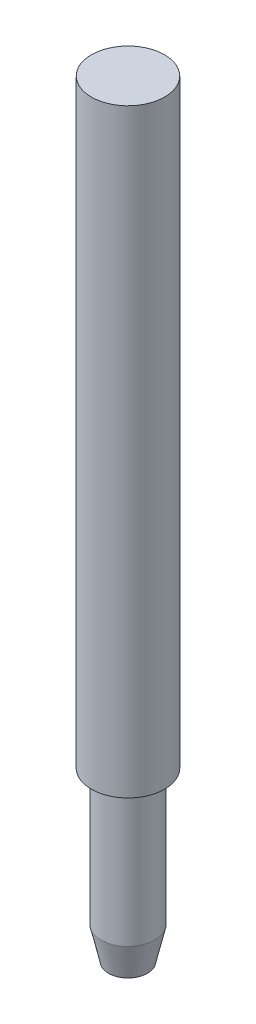
from build123d import *

# Parameters (mm, degrees)
SKETCH1_R           = 2.38125
BOSS_EXTRUDE1_DEPTH = 38.9763
SKETCH2_R           = 1.7526
BOSS_EXTRUDE2_DEPTH = 10.922


with BuildPart() as part:
    # Sketch1 → Boss-Extrude1 (new body)
    with BuildSketch(Plane(origin=(0, 0, 0), x_dir=(1, 0, 0), z_dir=(0, 1, 0))):
        Circle(SKETCH1_R)
    extrude(amount=BOSS_EXTRUDE1_DEPTH)

    # Sketch2 → Boss-Extrude2 (add)
    with BuildSketch(Plane.XZ):
        Circle(SKETCH2_R)
    extrude(amount=BOSS_EXTRUDE2_DEPTH)

    # Sketch3 → Cut-Revolve1 (revolve, cut)
    with BuildSketch(Plane(origin=(0, 0, 0), x_dir=(0, 0, -1), z_dir=(1, 0, 0))):
        Polygon((1.7526, -8.805333333), (1.27, -10.922), (1.7526, -10.922), align=None)
    revolve(axis=Axis((0, -10.922, 0), (0, 1, 0)), mode=Mode.SUBTRACT)


solid = part.part
